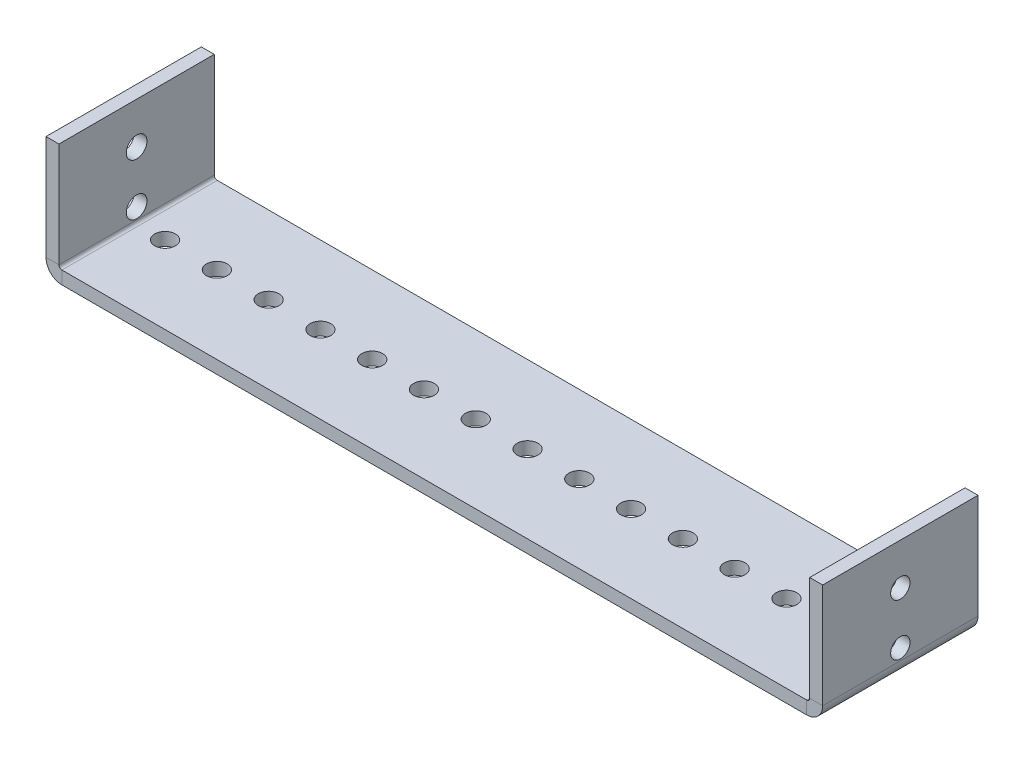
from build123d import *

# Parameters (mm, degrees)
SKETCH1_W                  = 241.3
SKETCH1_H                  = 38.1
BOSS_EXTRUDE1_DEPTH        = 3.175
SKETCH2_R                  = 2.54
CUT_EXTRUDE1_DEPTH         = 3.175
LPATTERN1_COUNT            = 16
LPATTERN1_PITCH            = 12.7
SKETCHED_START             = -120.65
SKETCHED_BEND2_OUTLINE_W   = 3.175
SKETCHED_BEND2_OUTLINE_H   = 38.1
SKETCHED_BEND2_DEPTH       = 25.4
SKETCHED_START_2           = -94.869557784
SKETCHED_BEND2_2_OUTLINE_W = 26.397512257
SKETCHED_BEND2_2_OUTLINE_H = 38.1
SKETCHED_BEND2_2_OUTLINE_R = 2.54
SKETCHED_BEND2_2_DEPTH     = 2.794557784
SKETCHED_START_3           = -95.25
SKETCHED_BEND2_3_OUTLINE_W = 26.397512257
SKETCHED_BEND2_3_OUTLINE_H = 38.1
SKETCHED_BEND2_3_OUTLINE_R = 2.54
SKETCHED_BEND2_3_DEPTH     = 3.9116
SKETCHED_START_4           = -20
SKETCHED_BEND2_4_DEPTH     = 40
SKETCHED_START_5           = -19.05
SKETCHED_BEND3_DEPTH       = 38.1
SKETCHED_BEND3_2_DEPTH     = 38.1
SKETCH28_R                 = 2.372260046
CUT_EXTRUDE2_DEPTH         = 10.922
LPATTERN2_COUNT            = 2
LPATTERN2_PITCH            = 12.7


with BuildPart() as part:
    # Sketch1 → Boss-Extrude1 (new body)
    with BuildSketch(Plane(origin=(0, 0, 0), x_dir=(1, 0, 0), z_dir=(0, 1, 0))):
        Rectangle(SKETCH1_W, SKETCH1_H)
    extrude(amount=BOSS_EXTRUDE1_DEPTH)

    # Sketch2 → Cut-Extrude1 (cut)
    with BuildSketch(Plane(origin=(0, 3.175, 0), x_dir=(1, 0, 0), z_dir=(0, 1, 0))):
        with Locations(Location((-110.49, 0, 0), (0, 0, 270))):
            Circle(SKETCH2_R)
    cut_extrude1 = extrude(amount=-CUT_EXTRUDE1_DEPTH, mode=Mode.SUBTRACT)

    # LPattern1: Cut-Extrude1 ×16
    with Locations(*[(i * LPATTERN1_PITCH, 0, 0) for i in range(1, LPATTERN1_COUNT)]):
        add(cut_extrude1, mode=Mode.SUBTRACT)

    # Sketched Bend2: read off the stored shape, not the designer's step
    # Sketched Bend2 outline → Sketched Bend2 (cut)
    with BuildSketch(Plane.YZ.offset(SKETCHED_START)):
        with Locations((1.5875, 0)):
            Rectangle(SKETCHED_BEND2_OUTLINE_W, SKETCHED_BEND2_OUTLINE_H)
    extrude(amount=SKETCHED_BEND2_DEPTH, mode=Mode.SUBTRACT)

    # Sketched Bend2 2 outline → Sketched Bend2 2 (add)
    with BuildSketch(Plane.YZ.offset(SKETCHED_START_2)):
        with Locations((16.373756129, 0)):
            Rectangle(SKETCHED_BEND2_2_OUTLINE_W, SKETCHED_BEND2_2_OUTLINE_H)
        with Locations((6.712512257, 0)):
            Circle(SKETCHED_BEND2_2_OUTLINE_R, mode=Mode.SUBTRACT)
        with Locations((19.412512257, 0)):
            Circle(SKETCHED_BEND2_2_OUTLINE_R, mode=Mode.SUBTRACT)
    extrude(amount=SKETCHED_BEND2_2_DEPTH)

    # Sketched Bend2 3 outline → Sketched Bend2 3 (add)
    with BuildSketch(Plane.YZ.offset(SKETCHED_START_3)):
        with Locations((16.373756129, 0)):
            Rectangle(SKETCHED_BEND2_3_OUTLINE_W, SKETCHED_BEND2_3_OUTLINE_H)
        with Locations((6.712512257, 0)):
            Circle(SKETCHED_BEND2_3_OUTLINE_R, mode=Mode.SUBTRACT)
        with Locations((19.412512257, 0)):
            Circle(SKETCHED_BEND2_3_OUTLINE_R, mode=Mode.SUBTRACT)
    extrude(amount=SKETCHED_BEND2_3_DEPTH)

    # Sketched Bend2 4 outline → Sketched Bend2 4 (cut)
    with BuildSketch(Plane.XY.offset(SKETCHED_START_4)):
        with BuildLine():
            ThreePointArc((-91.3384, 0), (-94.104318885, 1.145681115), (-95.25, 3.9116))
            Line((-95.25, 3.9116), (-95.25, 0))
            Line((-95.25, 0), (-91.3384, 0))
        make_face()
        with BuildLine():
            Line((-92.075, 29.572512257), (-92.075, 3.9116))
            ThreePointArc((-92.075, 3.9116), (-91.859254855, 3.390745145), (-91.3384, 3.175))
            Line((-91.3384, 3.175), (-91.3384, 29.572512257))
            Line((-91.3384, 29.572512257), (-92.075, 29.572512257))
        make_face()
    extrude(amount=SKETCHED_BEND2_4_DEPTH, mode=Mode.SUBTRACT)

    # Sketched Bend3: read off the stored shape, not the designer's step
    # Sketched Bend3 outline → Sketched Bend3 (cut)
    with BuildSketch(Plane.XY.offset(SKETCHED_START_5)):
        with BuildLine():
            Line((120.65, 3.175), (95.180018799, 3.175))
            ThreePointArc((95.180018799, 3.175), (93.830319942, 0.896479843), (91.3384, 0))
            Line((91.3384, 0), (120.65, 0))
            Line((120.65, 0), (120.65, 3.175))
        make_face()
    extrude(amount=SKETCHED_BEND3_DEPTH, mode=Mode.SUBTRACT)

    # Sketched Bend3 2 outline → Sketched Bend3 2 (add)
    with BuildSketch(Plane.XY.offset(SKETCHED_START_5)):
        with BuildLine():
            Line((95.25, 29.572512257), (92.075, 29.572512257))
            Line((92.075, 29.572512257), (92.075, 3.9116))
            ThreePointArc((92.075, 3.9116), (91.859254855, 3.390745145), (91.3384, 3.175))
            Line((91.3384, 3.175), (95.180018799, 3.175))
            ThreePointArc((95.180018799, 3.175), (95.232465398, 3.541641581), (95.25, 3.9116))
            Line((95.25, 3.9116), (95.25, 29.572512257))
        make_face()
    extrude(amount=SKETCHED_BEND3_2_DEPTH)

    # Sketch28 → Cut-Extrude2 (cut)
    with BuildSketch(Plane.ZY.offset(-92.075)):
        with Locations(Location((0, 19.412512257, 0), (0, 0, 270))):
            Circle(SKETCH28_R)
    cut_extrude2 = extrude(amount=-CUT_EXTRUDE2_DEPTH, mode=Mode.SUBTRACT)

    # LPattern2: Cut-Extrude2 ×2
    with Locations(*[(0, -i * LPATTERN2_PITCH, 0) for i in range(1, LPATTERN2_COUNT)]):
        add(cut_extrude2, mode=Mode.SUBTRACT)


solid = part.part
